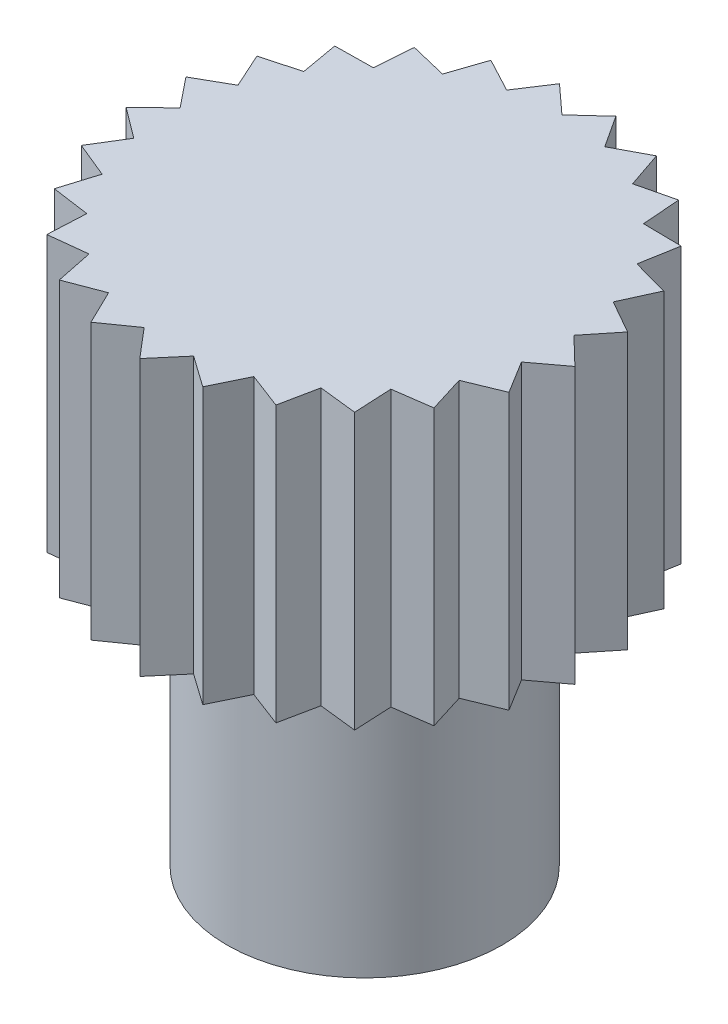
from build123d import *

# Parameters (mm, degrees)
SKETCH1_R           = 1.5
BOSS_EXTRUDE1_DEPTH = 3.01
BOSS_EXTRUDE2_DEPTH = 3


with BuildPart() as part:
    # Sketch1 → Boss-Extrude1 (new body)
    with BuildSketch(Plane(origin=(0, 0, 0), x_dir=(1, 0, 0), z_dir=(0, 1, 0))):
        Circle(SKETCH1_R)
    extrude(amount=BOSS_EXTRUDE1_DEPTH)

    # Sketch2 → Boss-Extrude2 (add)
    with BuildSketch(Plane(origin=(0, 3.01, 0), x_dir=(1, 0, 0), z_dir=(0, 1, 0))):
        Polygon((0.307066422, 2.430681018), (0.534683257, 2.082453796), (0.901905154, 2.27795239), (1.035770399, 1.884059362), (1.440073868, 1.982091636), (1.471776278, 1.567282549), (1.887757445, 1.561688775), (1.81530504, 1.152027609), (2.216826279, 1.043159264), (2.04477151, 0.664386538), (2.406603764, 0.459084221), (2.145757466, 0.134999617), (2.445165485, -0.153836773), (2.111917589, -0.402869826), (2.330088465, -0.757091636), (1.945378163, -0.915425477), (2.068603417, -1.312775648), (1.656603472, -1.370461578), (1.67714041, -1.785973137), (1.263738292, -1.739386538), (1.180296502, -2.146951366), (0.791467788, -1.999019445), (0.609290224, -2.373028745), (0.269466452, -2.133046608), (0, -2.45), (-0.269466452, -2.133046608), (-0.609290224, -2.373028745), (-0.791467788, -1.999019445), (-1.180296502, -2.146951366), (-1.263738292, -1.739386538), (-1.67714041, -1.785973137), (-1.656603472, -1.370461578), (-2.068603417, -1.312775648), (-1.945378163, -0.915425477), (-2.330088465, -0.757091636), (-2.111917589, -0.402869826), (-2.445165485, -0.153836773), (-2.145757466, 0.134999617), (-2.406603764, 0.459084221), (-2.04477151, 0.664386538), (-2.216826279, 1.043159264), (-1.81530504, 1.152027609), (-1.887757445, 1.561688775), (-1.471776278, 1.567282549), (-1.440073868, 1.982091636), (-1.035770399, 1.884059362), (-0.901905154, 2.27795239), (-0.534683257, 2.082453796), (-0.307066422, 2.430681018), (0, 2.15), align=None)
    extrude(amount=BOSS_EXTRUDE2_DEPTH)


solid = part.part
